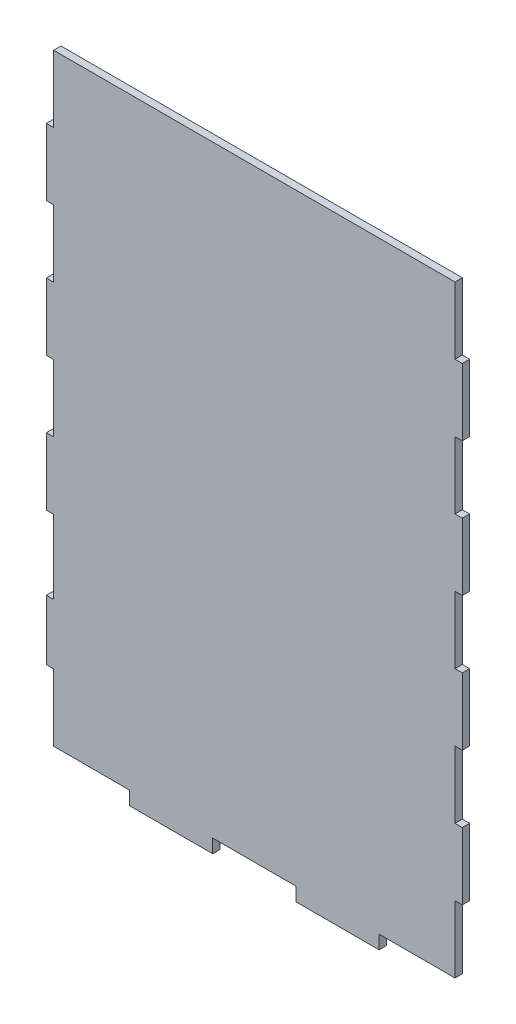
from build123d import *

# Parameters (mm, degrees)
BOSS_EXTRUDE2_DEPTH = 2.7


with BuildPart() as part:
    # Sketch1 → Boss-Extrude2 (new body)
    with BuildSketch(Plane.XY):
        Polygon((46.02, -108.65), (74, -108.65), (74, -83.95), (76.7, -83.95), (76.7, -59.25), (74, -59.25), (74, -34.55), (76.7, -34.55), (76.7, -9.85), (74, -9.85), (74, 14.85), (76.7, 14.85), (76.7, 39.55), (74, 39.55), (74, 64.25), (76.7, 64.25), (76.7, 88.95), (74, 88.95), (74, 113.65), (-74, 113.65), (-74, 88.95), (-76.7, 88.95), (-76.7, 64.25), (-74, 64.25), (-74, 39.55), (-76.7, 39.55), (-76.7, 14.85), (-74, 14.85), (-74, -9.85), (-76.7, -9.85), (-76.7, -34.55), (-74, -34.55), (-74, -59.25), (-74, -61.75), (-76.7, -61.75), (-76.7, -83.95), (-74, -83.95), (-74, -108.65), (-46.02, -108.65), (-46.02, -113.65), (-15.34, -113.65), (-15.34, -108.65), (15.34, -108.65), (15.34, -113.65), (46.02, -113.65), align=None)
    extrude(amount=BOSS_EXTRUDE2_DEPTH)


solid = part.part
